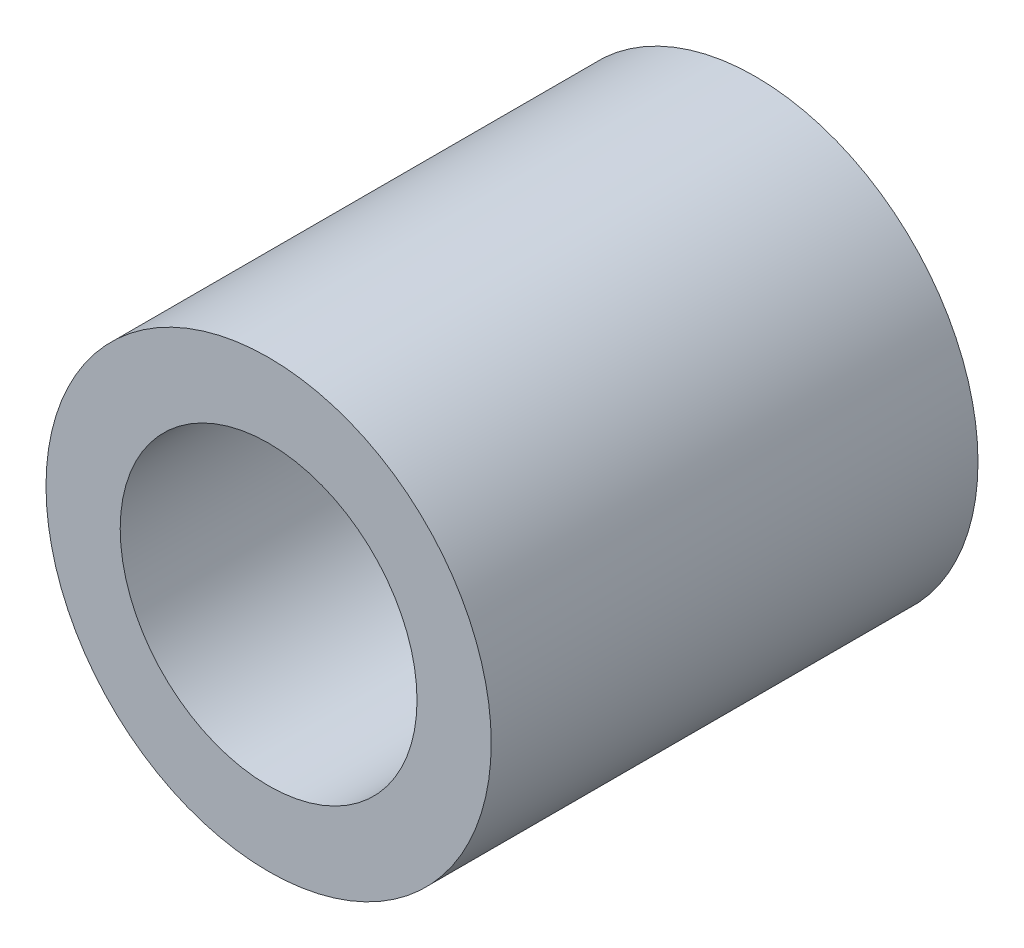
from build123d import *

# Parameters (mm, degrees)
SKETCH2_R           = 375
SKETCH2_R_2         = 250
BOSS_EXTRUDE1_DEPTH = 820


with BuildPart() as part:
    # Sketch2 → Boss-Extrude1 (new body)
    with BuildSketch(Plane.XY):
        Circle(SKETCH2_R)
        Circle(SKETCH2_R_2, mode=Mode.SUBTRACT)
    extrude(amount=BOSS_EXTRUDE1_DEPTH)


solid = part.part
